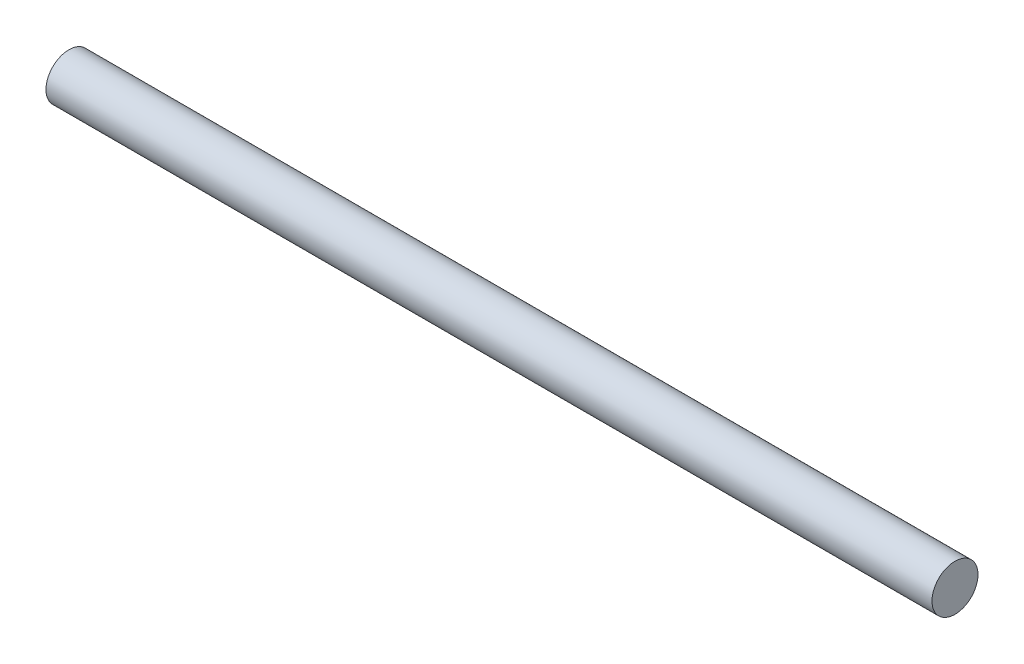
from build123d import *

# Parameters (mm, degrees)
ESBO_O1_R          = 4
FLANGE_BASE1_DEPTH = 154


# Sheet-metal steps are written as plain solids
with BuildPart() as part:
    # Esboço1 → Flange-base1 (new body)
    with BuildSketch(Plane(origin=(0, 0, 0), x_dir=(0, 0, -1), z_dir=(1, 0, 0))):
        Circle(ESBO_O1_R)
    extrude(amount=-FLANGE_BASE1_DEPTH)


solid = part.part
